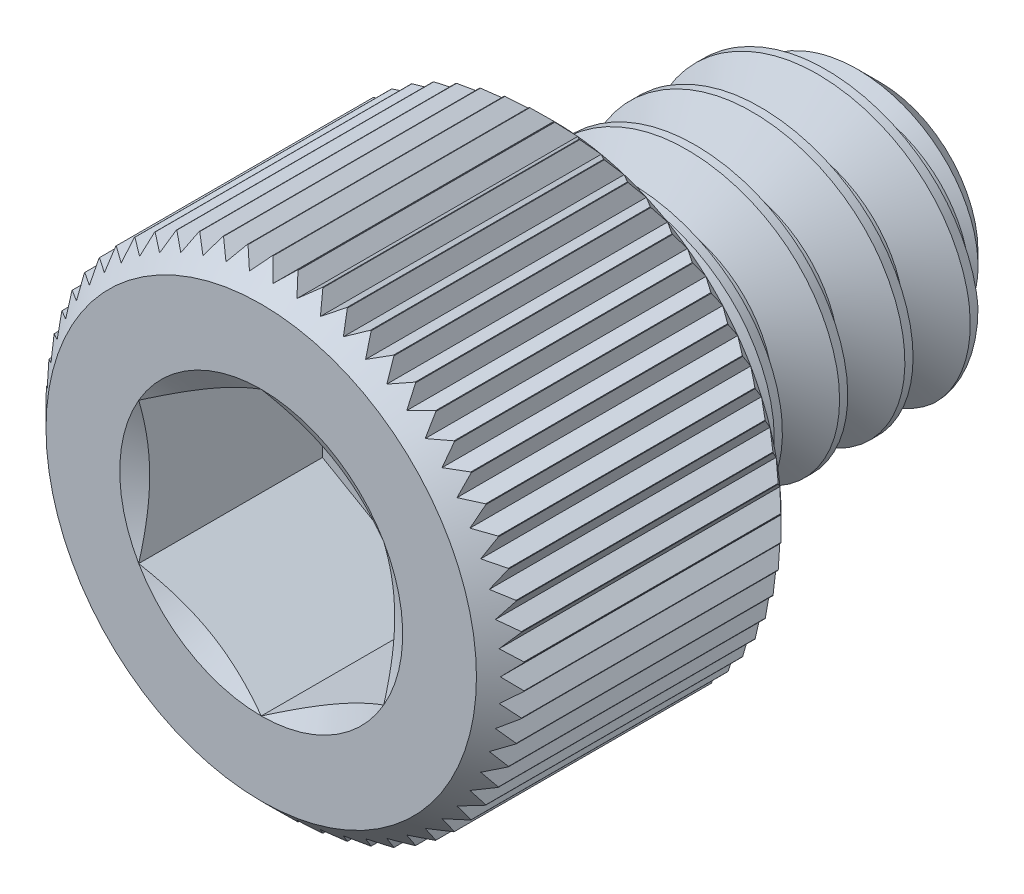
from build123d import *

# Parameters (mm, degrees)
CUT_EXTRUDE1_DEPTH        = 1.7859375
CHAMFER1_SIZE             = 0.23241
CHAMFER2_SIZE             = 0.116205
CUT_SWEEP1_PITCH          = 0.635
CUT_SWEEP1_TO             = 3.095625
BOSS_EXTRUDE5_START       = -1
BOSS_EXTRUDE5_OUTLINE_R   = 1.4859
BOSS_EXTRUDE5_OUTLINE_R_2 = 1.4224
BOSS_EXTRUDE5_DEPTH       = 1
CUT_EXTRUDE3_REACH        = 6.57
CIRPATTERN1_COUNT         = 60


with BuildPart() as part:
    # Sketch2 → Revolve1 (revolve)
    with BuildSketch(Plane(origin=(0, 0, 0), x_dir=(0, 0, -1), z_dir=(1, 0, 0)), mode=Mode.PRIVATE) as revolve1_sk:
        Polygon((3.0099, 0.94615), (2.53365, 1.4224), (-0.1651, 1.4224), (-0.1651, 2.3241), (-3.0099, 2.3241), (-3.0099, 0), (3.0099, 0), align=None)
    revolve(revolve1_sk.sketch.rotate(Axis((0, 0, -3.0099), (0, 0, 1)), 90), axis=Axis((0, 0, -3.0099), (0, 0, 1)))

    # Sketch4 → Cut-Extrude1 (cut)
    with BuildSketch(Plane.XY.offset(3.0099)):
        Polygon((0, 1.374815329), (-1.190625, 0.687407664), (-1.190625, -0.687407664), (0, -1.374815329), (1.190625, -0.687407664), (1.190625, 0.687407664), align=None)
    extrude(amount=-CUT_EXTRUDE1_DEPTH, mode=Mode.SUBTRACT)

    # Cut-Extrude2 cone 1 section (through the dimple's axis) → Cut-Extrude2 (revolve, cut)
    with BuildSketch(Plane(origin=(0, 0, 3.0099), x_dir=(0, -1, 0), z_dir=(1, 0, 0))):
        Polygon((0, 0), (1.374815329, 0), (0, 0.79375), align=None)
    revolve(axis=Axis((0, 0, 3.0099), (0, 0, -1)), mode=Mode.SUBTRACT)

    # Chamfer1
    chamfer1_edges = [part.edges().sort_by_distance(p)[0] for p in [
        (2.3241, 0, 3.0099),
    ]]
    chamfer(chamfer1_edges, length=CHAMFER1_SIZE)

    # Chamfer2
    chamfer2_edges = [part.edges().sort_by_distance(p)[0] for p in [
        (2.3241, 0, 0.1651),
    ]]
    chamfer(chamfer2_edges, length=CHAMFER2_SIZE)


with BuildPart() as body_2:
    # Split1: the piece on the far side of the plane
    add(part.part)
    split(bisect_by=Plane(origin=(0, 0, 0.085725), x_dir=(-1, 0, 0), z_dir=(0, 0, -1)), keep=Keep.BOTTOM)

    # Boss-Extrude5: read off the stored shape, not the designer's step
    # Boss-Extrude5 outline → Boss-Extrude5 (add)
    with BuildSketch(Plane(origin=(0, 0, 0.085725), x_dir=(-1, 0, 0), z_dir=(0, 0, -1)).offset(BOSS_EXTRUDE5_START)):
        Circle(BOSS_EXTRUDE5_OUTLINE_R)
        Circle(BOSS_EXTRUDE5_OUTLINE_R_2, mode=Mode.SUBTRACT)
    extrude(amount=BOSS_EXTRUDE5_DEPTH)


with BuildPart() as part_1:
    add(part.part)

    # Split1
    split(bisect_by=Plane(origin=(0, 0, 0.085725), x_dir=(-1, 0, 0), z_dir=(0, 0, -1)), keep=Keep.TOP)

    # Cut-Sweep1: arcs per turn and ends read off the stored shape
    # Cut-Sweep1: the profile of Sketch7 profile screwed along a right-hand helix through 6 turns, 6 arcs to a turn; built about Z, then put on its axis
    cut_sweep1_z = Axis((0, 0, 0), (0, 0, 1))
    cut_sweep1_corners = [(1.4227, 0, 0.000173205), (1.4227, 0, -0.555798205), (1.009955401, 0, -0.3175), (1.009955401, 0, -0.238125)]
    with BuildLine(mode=Mode.PRIVATE) as cut_sweep1_profile:
        Line(cut_sweep1_corners[0], cut_sweep1_corners[1])
        Line(cut_sweep1_corners[1], cut_sweep1_corners[2])
        Line(cut_sweep1_corners[2], cut_sweep1_corners[3])
        Line(cut_sweep1_corners[3], cut_sweep1_corners[0])
    cut_sweep1_cap = Face(cut_sweep1_profile.wire())
    cut_sweep1_turn_angles = [0, 30, 60, 90, 120, 150, 180, 210, 240, 270, 300, 330, 360]
    cut_sweep1_turn_weights = [1, 0.8660254037844387, 1, 0.8660254037844387, 1, 0.8660254037844387, 1, 0.8660254037844387, 1, 0.8660254037844387, 1, 0.8660254037844387, 1]
    cut_sweep1_turn_rails = [Edge.make_bspline([Vector(p[0], p[1], 0).rotate(cut_sweep1_z, cut_sweep1_turn_angles[k]) / cut_sweep1_turn_weights[k] + Vector(0, 0, p[2] + CUT_SWEEP1_PITCH * cut_sweep1_turn_angles[k] / 360) for k in range(13)], [0, 0, 0, 1, 1, 2, 2, 3, 3, 4, 4, 5, 5, 6, 6, 6], 2, cut_sweep1_turn_weights) for p in cut_sweep1_corners]
    cut_sweep1_turn_sides = [Face.make_surface_from_curves(cut_sweep1_turn_rails[p[0]], cut_sweep1_turn_rails[p[1]]) for p in [(0, 1), (1, 2), (2, 3), (3, 0)]]
    cut_sweep1 = Plane(origin=(0, 0, -3.0099), x_dir=(0, 1, 0), z_dir=(0, 0, 1)) * split(Solid(Shell([*[p.moved(Location((0, 0, CUT_SWEEP1_PITCH * i))) for i in range(6) for p in cut_sweep1_turn_sides], cut_sweep1_cap, cut_sweep1_cap.rotate(cut_sweep1_z, 2160).moved(Location((0, 0, CUT_SWEEP1_PITCH * 2160 / 360)))])), bisect_by=Plane.XY.offset(CUT_SWEEP1_TO), keep=Keep.BOTTOM, mode=Mode.PRIVATE)
    add(cut_sweep1, mode=Mode.SUBTRACT)

    add(body_2.part)  # Boss-Extrude4 merges body 2
    # Boss-Extrude4: read off the stored shape, not the designer's step
    # Boss-Extrude4 outline → Boss-Extrude4 (revolve)
    with BuildSketch(Plane.XZ):
        Polygon((1.009950696, 0.085725), (1.009950696, -0.187323486), (1.4859, 0.085725), align=None)
    revolve(axis=Axis((0, 0, 0), (0, 0, 1)))

    # Cut-Extrude3: up to this cone (the profile starts inside it)
    cut_extrude3_end = Plane(origin=(0, 0, 0.1651), z_dir=(0, 0, -1)).offset(-4.936489) * Cone(1e-06, 16.94298, 16.942979, align=(Align.CENTER, Align.CENTER, Align.MIN), mode=Mode.PRIVATE)
    # Sketch9 → Cut-Extrude3 (cut, up to the surface)
    with BuildSketch(Plane(origin=(0, 0, 0.1651), x_dir=(-1, 0, 0), z_dir=(0, 0, -1)), mode=Mode.PRIVATE) as cut_extrude3_sk1:
        Polygon((0, 2.207895), (-0.24360184, 2.440305), (0.24360184, 2.440305), align=None)
    cut_extrude3_tool1 = extrude(cut_extrude3_sk1.sketch, amount=-CUT_EXTRUDE3_REACH, mode=Mode.PRIVATE) & cut_extrude3_end
    cut_extrude3 = cut_extrude3_tool1.solids().sort_by_distance((0, 2.362835, 0.1651))[0]
    add(cut_extrude3, mode=Mode.SUBTRACT)

    # CirPattern1: Cut-Extrude3 ×60 about axis
    cirpattern1_axis = Axis((0, 0, 0), (0, 0, 1))
    for i in range(1, CIRPATTERN1_COUNT):
        add(cut_extrude3.rotate(cirpattern1_axis, i * 360 / CIRPATTERN1_COUNT), mode=Mode.SUBTRACT)


solid = part_1.part
